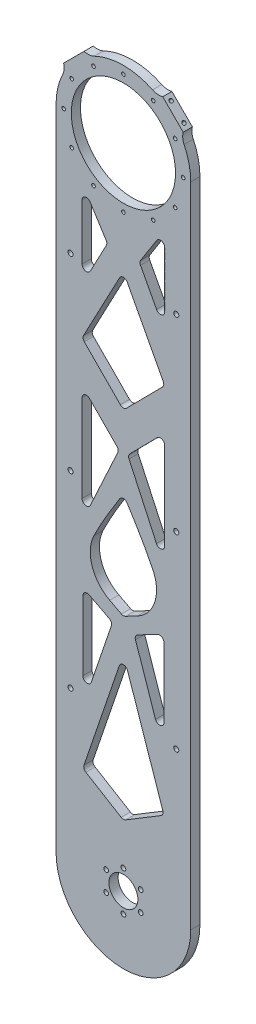
from build123d import *

# Parameters (mm, degrees)
SKETCH2_R                            = 10
SKETCH2_R_2                          = 1.65
BOSS_EXTRUDE1_DEPTH                  = 6.35
CUT_EXTRUDE1_DEPTH                   = 10
FILLET3_R                            = 3
SKETCH5_R                            = 1.75
CUT_EXTRUDE2_DEPTH                   = 549.511460792
SKETCH6_R                            = 26.5
CUT_EXTRUDE3_DEPTH                   = 10
BOSS_EXTRUDE2_START                  = -6.35
BOSS_EXTRUDE2_DEPTH                  = 6.35
TAP_DRILL_FOR_M3X0_5_TAP1_AT_2_COUNT = 2
TAP_DRILL_FOR_M3X0_5_TAP1_AT_2_PITCH = 12
CIRPATTERN2_COUNT                    = 2
CIRPATTERN2_ANGLE                    = 90
CUT_EXTRUDE4_DEPTH                   = 549.511460792
SKETCH11_R                           = 36
CUT_EXTRUDE5_DEPTH                   = 549.511460792
CUT_EXTRUDE6_DEPTH                   = 549.511460792
CUT_EXTRUDE6_DEPTH_BACK              = 549.511460792
SKETCH12_R                           = 1.25
SKETCH13_W                           = 93
SKETCH13_H                           = 53.952458561
CUT_EXTRUDE7_DEPTH                   = 549.511460792
BOSS_EXTRUDE3_REACH                  = 319.131
SKETCH14_W                           = 17.515975695
SKETCH14_H                           = 6.35
BOSS_EXTRUDE4_DEPTH                  = 6.35
SKETCH16_R                           = 1.75
CUT_EXTRUDE8_DEPTH                   = 497.007604239
SKETCH17_R                           = 1.75
BOSS_EXTRUDE5_DEPTH                  = 6.35
BOSS_EXTRUDE6_DEPTH                  = 6.35
M3X0_5_TAPPED_HOLE1_AT_2_COUNT       = 2
M3X0_5_TAPPED_HOLE1_AT_2_PITCH       = 12.5
CIRPATTERN3_COUNT                    = 2
CIRPATTERN3_ANGLE                    = 90
FILLET4_R                            = 10


with BuildPart() as part:
    # Sketch2 → Boss-Extrude1 (new body)
    with BuildSketch(Plane.XY):
        with BuildLine():
            Line((-46.5, 0), (-46.5, 500))
            ThreePointArc((-46.5, 500), (0, 546.5), (46.5, 500))
            Line((46.5, 500), (46.5, 0))
            ThreePointArc((46.5, 0), (0, -46.5), (-46.5, 0))
        make_face()
        Circle(SKETCH2_R, mode=Mode.SUBTRACT)
        with Locations((0, 13.75)):
            Circle(SKETCH2_R_2, mode=Mode.SUBTRACT)
        with Locations((11.907849302, 6.875)):
            Circle(SKETCH2_R_2, mode=Mode.SUBTRACT)
        with Locations((11.907849302, -6.875)):
            Circle(SKETCH2_R_2, mode=Mode.SUBTRACT)
        with Locations((0, -13.75)):
            Circle(SKETCH2_R_2, mode=Mode.SUBTRACT)
        with Locations((-11.907849302, -6.875)):
            Circle(SKETCH2_R_2, mode=Mode.SUBTRACT)
        with Locations((-11.907849302, 6.875)):
            Circle(SKETCH2_R_2, mode=Mode.SUBTRACT)
    extrude(amount=BOSS_EXTRUDE1_DEPTH)

    # Sketch4 → Cut-Extrude1 (cut)
    with BuildSketch(Plane.XY.offset(6.35)):
        Polygon((28.005258112, 59.37595418), (0, 42.411661153), (-28.005258112, 59.37595418), (0, 141.693437584), align=None)
        Polygon((-7.5, 156.905935087), (-28.005258112, 96.633637735), (-28.005258112, 167.582877854), align=None)
        Polygon((28.005258112, 167.582877854), (7.5, 156.905935087), (28.005258112, 96.633637735), align=None)
        with BuildLine():
            Line((0, 164.275138905), (28.550546746, 179.141206521))
            add(Edge.make_bspline(
                [(28.550546746, 179.141206521), (45.32025339, 216.985654627), (19.430092874, 259.790255689), (0, 290.025756679)],
                knots=[0, 0, 0, 0, 1, 1, 1, 1], degree=3))
            add(Edge.make_bspline(
                [(-28.550546746, 179.141206521), (-45.32025339, 216.985654627), (-19.430092874, 259.790255689), (0, 290.025756679)],
                knots=[0, 0, 0, 0, 1, 1, 1, 1], degree=3))
            Line((-28.550546746, 179.141206521), (0, 164.275138905))
        make_face()
        Polygon((28.550546746, 259.58677623), (3, 314.938284003), (28.550546746, 340.793051053), align=None)
        Polygon((-3, 314.938284003), (-28.550546746, 340.793051053), (-28.550546746, 259.58677623), align=None)
        Polygon((0, 423.142843498), (-28.550546746, 369.246205395), (0, 340.355718526), (28.550546746, 369.246205395), align=None)
        Polygon((-28.550546746, 462.095190817), (-28.550546746, 401.290241252), (-11, 434.421497018), align=None)
        Polygon((28.550546746, 401.290241252), (11, 434.421497018), (28.550546746, 462.095190817), align=None)
    extrude(amount=-CUT_EXTRUDE1_DEPTH, mode=Mode.SUBTRACT)

    # Fillet3
    fillet3_edges = [part.edges().sort_by_distance(p)[0] for p in [
        (-11, 434.421497018, 3.175),
        (-28.550546746, 401.290241252, 3.175),
        (28.550546746, 401.290241252, 3.175),
        (11, 434.421497018, 3.175),
        (28.550546746, 462.095190817, 3.175),
        (-28.550546746, 462.095190817, 3.175),
        (0, 423.142843498, 3.175),
        (-28.550546746, 369.246205395, 3.175),
        (28.550546746, 369.246205395, 3.175),
        (0, 340.355718526, 3.175),
        (28.550546746, 340.793051053, 3.175),
        (-28.550546746, 340.793051053, 3.175),
        (-3, 314.938284003, 3.175),
        (3, 314.938284003, 3.175),
        (28.550546746, 259.58677623, 3.175),
        (-28.550546746, 259.58677623, 3.175),
        (28.550546746, 179.141206521, 3.175),
        (0, 290.025756679, 3.175),
        (-28.550546746, 179.141206521, 3.175),
        (0, 164.275138905, 3.175),
        (-28.005258112, 96.633637735, 3.175),
        (28.005258112, 96.633637735, 3.175),
        (7.5, 156.905935087, 3.175),
        (-28.005258112, 167.582877854, 3.175),
        (28.005258112, 167.582877854, 3.175),
        (0, 141.693437584, 3.175),
        (28.005258112, 59.37595418, 3.175),
        (-28.005258112, 59.37595418, 3.175),
        (0, 42.411661153, 3.175),
        (-7.5, 156.905935087, 3.175),
    ]]
    fillet(fillet3_edges, radius=FILLET3_R)

    # Sketch5 → Cut-Extrude2 (cut, through all)
    with BuildSketch(Plane.XY.offset(6.35)):
        with Locations((36.5, 103.175)):
            Circle(SKETCH5_R)
        with Locations(Location((-36.5, 103.175, 0), (0, 0, 180))):
            Circle(SKETCH5_R)
        with Locations(Location((36.5, 259.525, 0), (0, 0, 180))):
            Circle(SKETCH5_R)
        with Locations((-36.5, 259.525)):
            Circle(SKETCH5_R)
        with Locations((36.5, 415.875)):
            Circle(SKETCH5_R)
        with Locations(Location((-36.5, 415.875, 0), (0, 0, 180))):
            Circle(SKETCH5_R)
    extrude(amount=-CUT_EXTRUDE2_DEPTH, mode=Mode.SUBTRACT)

    # Sketch6 → Cut-Extrude3 (cut)
    with BuildSketch(Plane.XY.offset(6.35)):
        with Locations((0, 500)):
            Circle(SKETCH6_R)
    extrude(amount=-CUT_EXTRUDE3_DEPTH, mode=Mode.SUBTRACT)

    # Sketch7 → Boss-Extrude2 (add)
    with BuildSketch(Plane.XY.offset(6.35).offset(BOSS_EXTRUDE2_START)):
        with BuildLine():
            Line((44.110383395, 529.968247771), (29.968247771, 544.110383395))
            ThreePointArc((29.968247771, 544.110383395), (23.286397782, 542.399293624), (16.474718596, 543.483717035))
            ThreePointArc((16.474718596, 543.483717035), (32.880465325, 532.880465325), (43.483717035, 516.474718596))
            ThreePointArc((43.483717035, 516.474718596), (42.399293624, 523.286397782), (44.110383395, 529.968247771))
        make_face()
    boss_extrude2 = extrude(amount=BOSS_EXTRUDE2_DEPTH)

    # Sketch9 → Tap Drill for M3x0.5 Tap1 (revolve, cut)
    with BuildSketch(Plane(origin=(32.796674896, 541.28195627, 3.175), x_dir=(-0.7071067811865481, 0.7071067811865469, 0), z_dir=(0, 0, 1))):
        Polygon((0, 0), (0, 5.751075774), (1.25, 5), (1.25, 0), align=None)
    tap_drill_for_m3x0_5_tap1 = revolve(axis=Axis((37.286802956, 545.772084331, 3.175), (-0.7071067811865468, -0.7071067811865482, 0)), mode=Mode.SUBTRACT)

    # Tap Drill for M3x0.5 Tap1 at 2: Tap Drill for M3x0.5 Tap1 ×2
    with Locations(*[Vector(0.7071067811865482, -0.7071067811865468, 0) * (i * TAP_DRILL_FOR_M3X0_5_TAP1_AT_2_PITCH) for i in range(1, TAP_DRILL_FOR_M3X0_5_TAP1_AT_2_COUNT)]):
        add(tap_drill_for_m3x0_5_tap1, mode=Mode.SUBTRACT)

    # CirPattern2: Boss-Extrude2, Tap Drill for M3x0.5 Tap1 ×2 about axis
    cirpattern2_axis = Axis((0, 500, 0), (0, 0, 1))
    add([boss_extrude2.rotate(cirpattern2_axis, i * CIRPATTERN2_ANGLE / (CIRPATTERN2_COUNT - 1)) for i in range(1, CIRPATTERN2_COUNT)])
    add([tap_drill_for_m3x0_5_tap1.rotate(cirpattern2_axis, i * CIRPATTERN2_ANGLE / (CIRPATTERN2_COUNT - 1)) for i in range(1, CIRPATTERN2_COUNT)], mode=Mode.SUBTRACT)

    # CirPattern2 copy 1 sketch → CirPattern2 copy 1 (revolve, cut)
    with BuildSketch(Plane(origin=(-32.796674896, 541.28195627, 3.175), x_dir=(-0.7071067811865445, -0.7071067811865506, 0), z_dir=(0, 0, 1))):
        Polygon((0, 0), (0, 5.751075774), (1.25, 5), (1.25, 0), align=None)
    revolve(axis=Axis((-37.286802956, 545.772084331, 3.175), (0.7071067811865507, -0.7071067811865444, 0)), mode=Mode.SUBTRACT)

    # Sketch10 → Cut-Extrude4 (cut, through all)
    with BuildSketch(Plane.XY.offset(6.35)):
        with BuildLine():
            Line((-43.483717035, 516.474718596), (-63.483717035, 516.474718596))
            ThreePointArc((-63.483717035, 516.474718596), (0, 565.586573942), (63.483717035, 516.474718596))
            Line((63.483717035, 516.474718596), (43.483717035, 516.474718596))
            ThreePointArc((43.483717035, 516.474718596), (0, 546.5), (-43.483717035, 516.474718596))
        make_face()
    extrude(amount=-CUT_EXTRUDE4_DEPTH, mode=Mode.SUBTRACT)

    # Sketch11 → Cut-Extrude5 (cut, through all)
    with BuildSketch(Plane.XY.offset(6.35)):
        with Locations((0, 500)):
            Circle(SKETCH11_R)
    extrude(amount=-CUT_EXTRUDE5_DEPTH, mode=Mode.SUBTRACT)

    # Sketch12 → Cut-Extrude6 (cut, two sides: drawn at the far end of the back side and taken through both)
    with BuildSketch(Plane.XY.offset(6.35).offset(-CUT_EXTRUDE6_DEPTH_BACK)):
        with Locations((0, 541.25)):
            Circle(SKETCH12_R)
        with Locations((20.625, 535.723547906)):
            Circle(SKETCH12_R)
        with Locations((35.723547906, 520.625)):
            Circle(SKETCH12_R)
        with Locations((41.25, 500)):
            Circle(SKETCH12_R)
        with Locations((35.723547906, 479.375)):
            Circle(SKETCH12_R)
        with Locations((20.625, 464.276452094)):
            Circle(SKETCH12_R)
        with Locations((0, 458.75)):
            Circle(SKETCH12_R)
        with Locations((-20.625, 464.276452094)):
            Circle(SKETCH12_R)
        with Locations((-35.723547906, 479.375)):
            Circle(SKETCH12_R)
        with Locations((-41.25, 500)):
            Circle(SKETCH12_R)
        with Locations((-35.723547906, 520.625)):
            Circle(SKETCH12_R)
        with Locations((-20.625, 535.723547906)):
            Circle(SKETCH12_R)
    extrude(amount=CUT_EXTRUDE6_DEPTH + CUT_EXTRUDE6_DEPTH_BACK, mode=Mode.SUBTRACT)

    # Sketch13 → Cut-Extrude7 (cut, through all)
    with BuildSketch(Plane(origin=(0, 0, 0), x_dir=(-1, 0, 0), z_dir=(0, 0, -1))):
        with Locations((0, 207.119171895)):
            Rectangle(SKETCH13_W, SKETCH13_H)
    extrude(amount=-CUT_EXTRUDE7_DEPTH, mode=Mode.SUBTRACT)


with BuildPart() as cut_extrude7_piece_1:
    # of the separate pieces the step leaves, piece 1, a body of its own (cut_extrude7_pieces)
    add(part.part.solids().sort_by_distance((46.5, 500, 0))[0])


with BuildPart() as cut_extrude7_piece_2:
    # of the separate pieces the step leaves, piece 2, a body of its own (cut_extrude7_pieces)
    add(part.part.solids().sort_by_distance((46.5, 180.142942614, 0))[0])


with BuildPart() as cut_extrude7_piece_1_1:
    # Body-Move/Copy1: moved
    add(cut_extrude7_piece_1.part.moved(Location((0, -52.7176888, 0))))

    # Boss-Extrude3: up to this face of the body (flat: up to its plane)
    boss_extrude3_end = Plane(cut_extrude7_piece_1_1.part.faces().sort_by_distance((37.742012152, 181.377712375, 3.175))[0])
    # Sketch14 → Boss-Extrude3 (add, up to the picked face)
    with BuildSketch(Plane(origin=(0, 180.142942614, 0), x_dir=(1, 0, 0), z_dir=(0, 1, 0)), mode=Mode.PRIVATE) as boss_extrude3_sk1:
        with Locations((-37.742012153, -3.175)):
            Rectangle(SKETCH14_W, SKETCH14_H)
    boss_extrude3_tool1 = split(extrude(boss_extrude3_sk1.sketch, amount=BOSS_EXTRUDE3_REACH, mode=Mode.PRIVATE), bisect_by=boss_extrude3_end, keep=Keep.BOTH, mode=Mode.PRIVATE)
    # Sketch14 → Boss-Extrude3 (add, up to the picked face)
    with BuildSketch(Plane(origin=(0, 180.142942614, 0), x_dir=(1, 0, 0), z_dir=(0, 1, 0)), mode=Mode.PRIVATE) as boss_extrude3_sk2:
        with Locations((37.742012153, -3.175)):
            Rectangle(SKETCH14_W, SKETCH14_H)
    boss_extrude3_tool2 = split(extrude(boss_extrude3_sk2.sketch, amount=BOSS_EXTRUDE3_REACH, mode=Mode.PRIVATE), bisect_by=boss_extrude3_end, keep=Keep.BOTH, mode=Mode.PRIVATE)

    add(cut_extrude7_piece_2.part)  # Boss-Extrude3 merges Cut-Extrude7 piece 2
    add(boss_extrude3_tool1.solids().sort_by(Axis((-37.742012, 180.142943, 3.175), (0, 1, 0)))[0])
    add(boss_extrude3_tool2.solids().sort_by(Axis((37.742012, 180.142943, 3.175), (0, 1, 0)))[0])

    # Sketch15 → Boss-Extrude4 (add)
    with BuildSketch(Plane(origin=(0, 0, 0), x_dir=(-1, 0, 0), z_dir=(0, 0, -1))):
        with BuildLine():
            Line((28.984024305, 181.377712375), (28.984024305, 180.142942614))
            ThreePointArc((28.984024305, 180.142942614), (28.425309599, 179.275911344), (27.605954054, 178.649363792))
            Line((27.605954054, 178.649363792), (9.43812576, 169.189504186))
            ThreePointArc((9.43812576, 169.189504186), (21.644913421, 183.565600372), (20.334408511, 202.379435266))
            add(Edge.make_bspline(
                [(28.984024305, 181.377712375), (26.665870811, 188.528361062), (23.678798122, 195.56600215), (20.334408511, 202.379435266)],
                knots=[0.471090389, 0.471090389, 0.471090389, 0.471090389, 0.656207947, 0.656207947, 0.656207947, 0.656207947], degree=3))
        make_face()
        with BuildLine():
            Line((-9.43812576, 169.189504186), (-27.605954054, 178.649363792))
            ThreePointArc((-27.605954054, 178.649363792), (-28.425309599, 179.275911344), (-28.984024305, 180.142942614))
            Line((-28.984024305, 180.142942614), (-28.984024304, 181.377712375))
            add(Edge.make_bspline(
                [(-28.984024304, 181.377712375), (-26.665870811, 188.528361062), (-23.678798122, 195.56600215), (-20.334408511, 202.379435266)],
                knots=[0.471090389, 0.471090389, 0.471090389, 0.471090389, 0.656207947, 0.656207947, 0.656207947, 0.656207947], degree=3))
            ThreePointArc((-20.334408511, 202.379435266), (-21.644913421, 183.565600372), (-9.43812576, 169.189504186))
        make_face()
    extrude(amount=-BOSS_EXTRUDE4_DEPTH)

    # Sketch16 → Cut-Extrude8 (cut, through all)
    with BuildSketch(Plane(origin=(0, 0, 0), x_dir=(-1, 0, 0), z_dir=(0, 0, -1))):
        with Locations((36.5, 233.1661556)):
            Circle(SKETCH16_R)
        with Locations((-36.5, 233.1661556)):
            Circle(SKETCH16_R)
    extrude(amount=-CUT_EXTRUDE8_DEPTH, mode=Mode.SUBTRACT)

    # Sketch17 → Boss-Extrude5 (add)
    with BuildSketch(Plane(origin=(0, 0, 0), x_dir=(-1, 0, 0), z_dir=(0, 0, -1))):
        with Locations((36.5, 206.8073112)):
            Circle(SKETCH17_R)
        with Locations((-36.5, 206.8073112)):
            Circle(SKETCH17_R)
    extrude(amount=-BOSS_EXTRUDE5_DEPTH)

    # Sketch18 → Boss-Extrude6 (add)
    with BuildSketch(Plane(origin=(0, 0, 0), x_dir=(-1, 0, 0), z_dir=(0, 0, -1))):
        Polygon((25.040067328, 486.464514152), (27.161387672, 488.585834496), (41.303523296, 474.443698872), (39.182202952, 472.322378528), align=None)
        Polygon((-39.182202952, 472.322378528), (-41.303523296, 474.443698872), (-27.161387672, 488.585834496), (-25.040067328, 486.464514152), align=None)
    extrude(amount=-BOSS_EXTRUDE6_DEPTH)

    # Sketch21 → M3x0.5 Tapped Hole1 (revolve, cut)
    with BuildSketch(Plane(origin=(-29.813038101, 485.934184066, 3.175), x_dir=(-0.707106781186547, -0.7071067811865481, 0), z_dir=(0, 0, 1))):
        Polygon((0, 0), (0, 8.251075774), (1.25, 7.5), (1.25, 0), align=None)
    m3x0_5_tapped_hole1 = revolve(axis=Axis((-34.303166162, 490.424312127, 3.175), (0.7071067811865481, -0.7071067811865469, 0)), mode=Mode.SUBTRACT)

    # M3x0.5 Tapped Hole1 at 2: M3x0.5 Tapped Hole1 ×2
    with Locations(*[Vector(-0.7071067811865469, -0.7071067811865481, 0) * (i * M3X0_5_TAPPED_HOLE1_AT_2_PITCH) for i in range(1, M3X0_5_TAPPED_HOLE1_AT_2_COUNT)]):
        add(m3x0_5_tapped_hole1, mode=Mode.SUBTRACT)

    # CirPattern3: M3x0.5 Tapped Hole1 ×2 about axis
    cirpattern3_axis = Axis((0, 447.2823112, 0), (0, 0, -1))
    for i in range(1, CIRPATTERN3_COUNT):
        add(m3x0_5_tapped_hole1.rotate(cirpattern3_axis, i * CIRPATTERN3_ANGLE / (CIRPATTERN3_COUNT - 1)), mode=Mode.SUBTRACT)

    # CirPattern3 copy 1 sketch → CirPattern3 copy 1 (revolve, cut)
    with BuildSketch(Plane(origin=(29.813038101, 485.934184066, 3.175), x_dir=(-0.7071067811865457, 0.7071067811865495, 0), z_dir=(0, 0, 1))):
        Polygon((0, 0), (0, 8.251075774), (1.25, 7.5), (1.25, 0), align=None)
    revolve(axis=Axis((34.303166162, 490.424312127, 3.175), (-0.7071067811865493, -0.7071067811865457, 0)), mode=Mode.SUBTRACT)

    # Fillet4
    # the kernel refuses this fillet: 10 mm, written as the material it adds along each edge
    with BuildSketch(Plane(origin=(-25.040067328, 486.464514152, 0), x_dir=(-0.7071067811865487, 0.7071067811865464, 0), z_dir=(0, 0, 1)), Plane(origin=(39.182202952, 472.322378528, 0), x_dir=(0.7071067811865666, 0.7071067811865286, 0), z_dir=(0, 0, 1))) as fillet4_piece_1:
        with BuildLine():
            CenterArc((7.897030706, -8.71889272), FILLET4_R, 119.321067137, 41.330757835)
            Line((-1.538196466, -5.405814363), (-1.72690101, -5.339552795))
            ThreePointArc((-1.72690101, -5.339552795), (-0.879713349, -2.671432223), (-0.195320442, 0.043010753))
            Line((-0.195320442, 0.043010753), (0, 0.2))
            ThreePointArc((0, 0.2), (1.5, 0.2), (2.902059386, 0.174377854))
            Line((2.902059386, 0.174377854), (3, 0))
        make_face()
    extrude(amount=6.35)
    with BuildSketch(Plane(origin=(-39.182202952, 472.322378528, 0), x_dir=(-0.486588082362211, -0.8736315230708346, 0), z_dir=(0, 0, 1)), Plane(origin=(25.040067328, 486.464514152, 0), x_dir=(-0.873631523070838, 0.4865880823622048, 0), z_dir=(0, 0, 1))) as fillet4_piece_2:
        with BuildLine():
            CenterArc((6.224742227, -9.981721717), FILLET4_R, 93.464746761, 41.330757835)
            Line((-0.821043125, -2.885461521), (-0.961958832, -2.743536317))
            ThreePointArc((-0.961958832, -2.743536317), (-0.602885664, -1.387994552), (-0.192364101, 0.054736208))
            Line((-0.192364101, 0.054736208), (0.012086878, 0.199634434))
            ThreePointArc((0.012086878, 0.199634434), (2.810199161, 0.115005986), (5.608311443, 0.199634434))
            Line((5.608311443, 0.199634434), (5.620398321, 0))
        make_face()
    extrude(amount=6.35)


solid = cut_extrude7_piece_1_1.part
